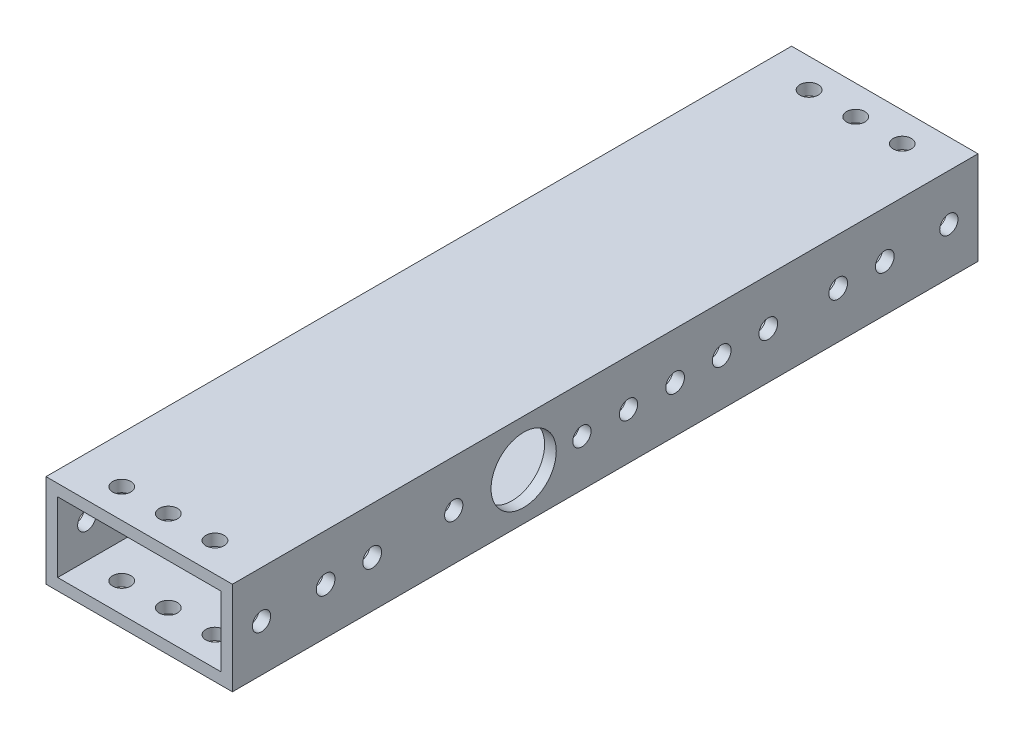
from build123d import *

# Parameters (mm, degrees)
SKETCH1_W           = 50.8
SKETCH1_H           = 25.4
SKETCH1_W_2         = 44.45
SKETCH1_H_2         = 19.05
BOSS_EXTRUDE1_DEPTH = 101.6
SKETCH3_R           = 2.4892
CUT_EXTRUDE2_DEPTH  = 108.763073453
SKETCH4_R           = 8.89
SKETCH4_R_2         = 2.5527
CUT_EXTRUDE3_DEPTH  = 115.3
SKETCH2_R           = 2.4892
SKETCH2_R_2         = 2.5527
CUT_EXTRUDE1_DEPTH  = 115.3
CUT_EXTRUDE4_REACH  = 109.763
SKETCH5_R           = 2.4892
CUT_EXTRUDE5_REACH  = 116.3
SKETCH7_R           = 2.5527
SKETCH7_R_2         = 2.4892


with BuildPart() as part:
    # Sketch1 → Boss-Extrude1 (new, symmetric)
    with BuildSketch(Plane.XY):
        Rectangle(SKETCH1_W, SKETCH1_H)
        Rectangle(SKETCH1_W_2, SKETCH1_H_2, mode=Mode.SUBTRACT)
    extrude(amount=BOSS_EXTRUDE1_DEPTH, both=True)

    # Sketch3 → Cut-Extrude2 (cut, through all)
    with BuildSketch(Plane(origin=(0, 12.7, 0), x_dir=(1, 0, 0), z_dir=(0, 1, 0))):
        with Locations((-12.7, -93.6625)):
            Circle(SKETCH3_R)
        with Locations((0, -93.6625)):
            Circle(SKETCH3_R)
        with Locations((12.7, -93.6625)):
            Circle(SKETCH3_R)
        with Locations((12.7, 93.6625)):
            Circle(SKETCH3_R)
        with Locations((0, 93.6625)):
            Circle(SKETCH3_R)
        with Locations((-12.7, 93.6625)):
            Circle(SKETCH3_R)
    extrude(amount=-CUT_EXTRUDE2_DEPTH, mode=Mode.SUBTRACT)

    # Sketch4 → Cut-Extrude3 (cut, through all)
    with BuildSketch(Plane(origin=(25.4, 0, 0), x_dir=(0, 0, -1), z_dir=(1, 0, 0))):
        with Locations((-22.225, 0)):
            Circle(SKETCH4_R)
        with Locations((31.75, 0)):
            Circle(SKETCH4_R_2)
        with Locations((19.05, 0)):
            Circle(SKETCH4_R_2)
    extrude(amount=-CUT_EXTRUDE3_DEPTH, mode=Mode.SUBTRACT)

    # Sketch2 → Cut-Extrude1 (cut, through all)
    with BuildSketch(Plane(origin=(25.4, 0, 0), x_dir=(0, 0, -1), z_dir=(1, 0, 0))):
        with Locations((-93.6625, 0)):
            Circle(SKETCH2_R)
        with Locations((93.6625, 0)):
            Circle(SKETCH2_R)
        with Locations((-76.2, 0)):
            Circle(SKETCH2_R_2)
        with Locations((-63.5, 0)):
            Circle(SKETCH2_R_2)
        with Locations((63.5, 0)):
            Circle(SKETCH2_R_2)
        with Locations((76.2, 0)):
            Circle(SKETCH2_R_2)
    extrude(amount=-CUT_EXTRUDE1_DEPTH, mode=Mode.SUBTRACT)

    # Sketch5 → Cut-Extrude4 (cut, up to next)
    with BuildSketch(Plane.XZ.offset(12.7), mode=Mode.PRIVATE) as cut_extrude4_sk1:
        with Locations((-3.175, 66.675)):
            Circle(SKETCH5_R)
    cut_extrude4_tool1 = extrude(cut_extrude4_sk1.sketch, amount=-CUT_EXTRUDE4_REACH, mode=Mode.PRIVATE) & part.part
    # Sketch5 → Cut-Extrude4 (cut, up to next)
    with BuildSketch(Plane.XZ.offset(12.7), mode=Mode.PRIVATE) as cut_extrude4_sk2:
        with Locations((-15.875, 66.675)):
            Circle(SKETCH5_R)
    cut_extrude4_tool2 = extrude(cut_extrude4_sk2.sketch, amount=-CUT_EXTRUDE4_REACH, mode=Mode.PRIVATE) & part.part
    # Sketch5 → Cut-Extrude4 (cut, up to next)
    with BuildSketch(Plane.XZ.offset(12.7), mode=Mode.PRIVATE) as cut_extrude4_sk3:
        with Locations((-15.875, 53.975)):
            Circle(SKETCH5_R)
    cut_extrude4_tool3 = extrude(cut_extrude4_sk3.sketch, amount=-CUT_EXTRUDE4_REACH, mode=Mode.PRIVATE) & part.part
    # Sketch5 → Cut-Extrude4 (cut, up to next)
    with BuildSketch(Plane.XZ.offset(12.7), mode=Mode.PRIVATE) as cut_extrude4_sk4:
        with Locations((-3.175, 53.975)):
            Circle(SKETCH5_R)
    cut_extrude4_tool4 = extrude(cut_extrude4_sk4.sketch, amount=-CUT_EXTRUDE4_REACH, mode=Mode.PRIVATE) & part.part
    # Sketch5 → Cut-Extrude4 (cut, up to next)
    with BuildSketch(Plane.XZ.offset(12.7), mode=Mode.PRIVATE) as cut_extrude4_sk5:
        with Locations((-3.175, -9.525)):
            Circle(SKETCH5_R)
    cut_extrude4_tool5 = extrude(cut_extrude4_sk5.sketch, amount=-CUT_EXTRUDE4_REACH, mode=Mode.PRIVATE) & part.part
    # Sketch5 → Cut-Extrude4 (cut, up to next)
    with BuildSketch(Plane.XZ.offset(12.7), mode=Mode.PRIVATE) as cut_extrude4_sk6:
        with Locations((-15.875, -9.525)):
            Circle(SKETCH5_R)
    cut_extrude4_tool6 = extrude(cut_extrude4_sk6.sketch, amount=-CUT_EXTRUDE4_REACH, mode=Mode.PRIVATE) & part.part
    # Sketch5 → Cut-Extrude4 (cut, up to next)
    with BuildSketch(Plane.XZ.offset(12.7), mode=Mode.PRIVATE) as cut_extrude4_sk7:
        with Locations((-15.875, -22.225)):
            Circle(SKETCH5_R)
    cut_extrude4_tool7 = extrude(cut_extrude4_sk7.sketch, amount=-CUT_EXTRUDE4_REACH, mode=Mode.PRIVATE) & part.part
    # Sketch5 → Cut-Extrude4 (cut, up to next)
    with BuildSketch(Plane.XZ.offset(12.7), mode=Mode.PRIVATE) as cut_extrude4_sk8:
        with Locations((-3.175, -22.225)):
            Circle(SKETCH5_R)
    cut_extrude4_tool8 = extrude(cut_extrude4_sk8.sketch, amount=-CUT_EXTRUDE4_REACH, mode=Mode.PRIVATE) & part.part
    add(cut_extrude4_tool1.solids().sort_by_distance((-3.175, -12.7, 66.675))[0], mode=Mode.SUBTRACT)
    add(cut_extrude4_tool2.solids().sort_by_distance((-15.875, -12.7, 66.675))[0], mode=Mode.SUBTRACT)
    add(cut_extrude4_tool3.solids().sort_by_distance((-15.875, -12.7, 53.975))[0], mode=Mode.SUBTRACT)
    add(cut_extrude4_tool4.solids().sort_by_distance((-3.175, -12.7, 53.975))[0], mode=Mode.SUBTRACT)
    add(cut_extrude4_tool5.solids().sort_by_distance((-3.175, -12.7, -9.525))[0], mode=Mode.SUBTRACT)
    add(cut_extrude4_tool6.solids().sort_by_distance((-15.875, -12.7, -9.525))[0], mode=Mode.SUBTRACT)
    add(cut_extrude4_tool7.solids().sort_by_distance((-15.875, -12.7, -22.225))[0], mode=Mode.SUBTRACT)
    add(cut_extrude4_tool8.solids().sort_by_distance((-3.175, -12.7, -22.225))[0], mode=Mode.SUBTRACT)

    # Sketch7 → Cut-Extrude5 (cut, up to next)
    with BuildSketch(Plane(origin=(25.4, 0, 0), x_dir=(0, 0, -1), z_dir=(1, 0, 0)), mode=Mode.PRIVATE) as cut_extrude5_sk1:
        with Locations((44.45, 0)):
            Circle(SKETCH7_R)
    cut_extrude5_tool1 = extrude(cut_extrude5_sk1.sketch, amount=-CUT_EXTRUDE5_REACH, mode=Mode.PRIVATE) & part.part
    # Sketch7 → Cut-Extrude5 (cut, up to next)
    with BuildSketch(Plane(origin=(25.4, 0, 0), x_dir=(0, 0, -1), z_dir=(1, 0, 0)), mode=Mode.PRIVATE) as cut_extrude5_sk2:
        with Locations((6.35, 0)):
            Circle(SKETCH7_R_2)
    cut_extrude5_tool2 = extrude(cut_extrude5_sk2.sketch, amount=-CUT_EXTRUDE5_REACH, mode=Mode.PRIVATE) & part.part
    # Sketch7 → Cut-Extrude5 (cut, up to next)
    with BuildSketch(Plane(origin=(25.4, 0, 0), x_dir=(0, 0, -1), z_dir=(1, 0, 0)), mode=Mode.PRIVATE) as cut_extrude5_sk3:
        with Locations((-6.35, 0)):
            Circle(SKETCH7_R_2)
    cut_extrude5_tool3 = extrude(cut_extrude5_sk3.sketch, amount=-CUT_EXTRUDE5_REACH, mode=Mode.PRIVATE) & part.part
    # Sketch7 → Cut-Extrude5 (cut, up to next)
    with BuildSketch(Plane(origin=(25.4, 0, 0), x_dir=(0, 0, -1), z_dir=(1, 0, 0)), mode=Mode.PRIVATE) as cut_extrude5_sk4:
        with Locations((-41.275, 0)):
            Circle(SKETCH7_R_2)
    cut_extrude5_tool4 = extrude(cut_extrude5_sk4.sketch, amount=-CUT_EXTRUDE5_REACH, mode=Mode.PRIVATE) & part.part
    add(cut_extrude5_tool1.solids().sort_by_distance((25.4, 0, -44.45))[0], mode=Mode.SUBTRACT)
    add(cut_extrude5_tool2.solids().sort_by_distance((25.4, 0, -6.35))[0], mode=Mode.SUBTRACT)
    add(cut_extrude5_tool3.solids().sort_by_distance((25.4, 0, 6.35))[0], mode=Mode.SUBTRACT)
    add(cut_extrude5_tool4.solids().sort_by_distance((25.4, 0, 41.275))[0], mode=Mode.SUBTRACT)


solid = part.part
